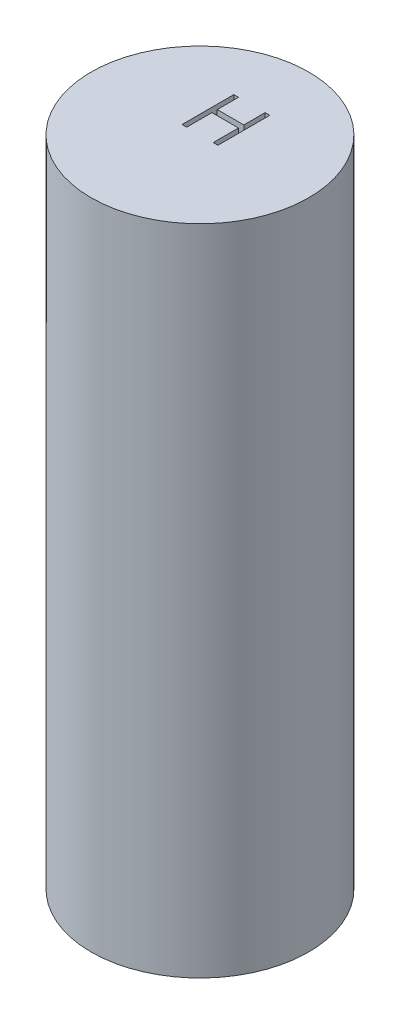
from build123d import *

# Parameters (mm, degrees)
SKETCH1_R           = 10
BOSS_EXTRUDE1_DEPTH = 4
SKETCH2_R           = 10
SKETCH2_R_2         = 8
SKETCH2_R_3         = 1.5
BOSS_EXTRUDE2_DEPTH = 52
SKETCH3_R           = 10
BOSS_EXTRUDE3_DEPTH = 4
CUT_EXTRUDE1_DEPTH  = 2


with BuildPart() as part:
    # Sketch1 → Boss-Extrude1 (new body)
    with BuildSketch(Plane(origin=(0, 0, 0), x_dir=(1, 0, 0), z_dir=(0, 1, 0))):
        Circle(SKETCH1_R)
    extrude(amount=BOSS_EXTRUDE1_DEPTH)

    # Sketch2 → Boss-Extrude2 (add)
    # profile 1 of 2: a face of its own
    with BuildSketch(Plane(origin=(0, 4, 0), x_dir=(1, 0, 0), z_dir=(0, 1, 0))):
        Circle(SKETCH2_R)
        Circle(SKETCH2_R_2, mode=Mode.SUBTRACT)
    # profile 2 of 2: a face of its own
    with BuildSketch(Plane(origin=(0, 4, 0), x_dir=(1, 0, 0), z_dir=(0, 1, 0))):
        Circle(SKETCH2_R_3)
    extrude(amount=BOSS_EXTRUDE2_DEPTH)

    # Sketch3 → Boss-Extrude3 (add)
    with BuildSketch(Plane(origin=(0, 56, 0), x_dir=(1, 0, 0), z_dir=(0, 1, 0))):
        Circle(SKETCH3_R)
    extrude(amount=BOSS_EXTRUDE3_DEPTH)

    # Sketch4 → Cut-Extrude1 (cut)
    with BuildSketch(Plane(origin=(0, 60, 0), x_dir=(1, 0, 0), z_dir=(0, 1, 0))):
        Polygon((-1.648557692, 4.7625), (-1.221153846, 4.7625), (-1.221153846, 2.808653846), (1.221153846, 2.808653846), (1.221153846, 4.7625), (1.648557692, 4.7625), (1.648557692, 0), (1.221153846, 0), (1.221153846, 2.320192308), (-1.221153846, 2.320192308), (-1.221153846, 0), (-1.648557692, 0), align=None)
    extrude(amount=-CUT_EXTRUDE1_DEPTH, mode=Mode.SUBTRACT)


solid = part.part
